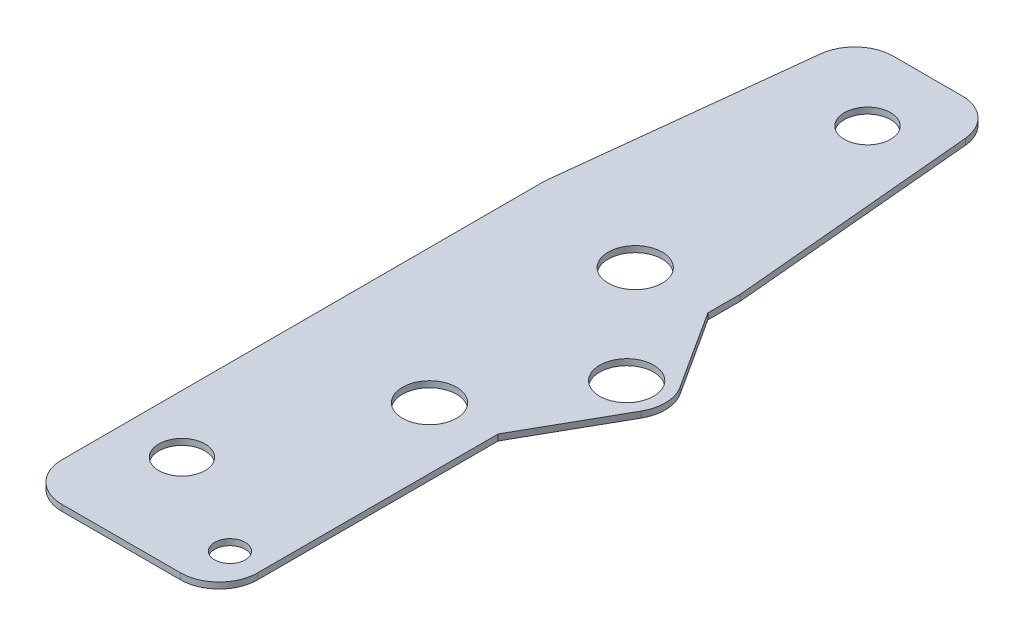
from build123d import *

# Parameters (mm, degrees)
SKETCH1_R           = 5.969
SKETCH1_R_2         = 3.960069723
SKETCH1_R_3         = 7
SKETCH1_R_4         = 6
BOSS_EXTRUDE1_DEPTH = 1.5875
SKETCH4_W           = 66.272407177
SKETCH4_H           = 27.800260981
CUT_EXTRUDE2_DEPTH  = 20
SKETCH5_R           = 6.683690244
BOSS_EXTRUDE2_DEPTH = 1.5875
SKETCH6_R           = 6
CUT_EXTRUDE3_DEPTH  = 2
FILLET3_R           = 10
FILLET4_R           = 10
BOSS_EXTRUDE6_START = -1.5875
BOSS_EXTRUDE6_DEPTH = 1.5875
SKETCH15_R          = 7
CUT_EXTRUDE5_DEPTH  = 1.5875


with BuildPart() as part:
    # Sketch1 → Boss-Extrude1 (new body)
    with BuildSketch(Plane(origin=(0, 0, 0), x_dir=(1, 0, 0), z_dir=(0, 1, 0))):
        with BuildLine():
            Line((42.32729629, 228.6), (10.454309325, 228.6))
            Line((10.454309325, 228.6), (0, 135.362739137))
            Line((0, 135.362739137), (0, 0))
            Line((0, 0), (24.327009544, 0))
            Line((24.327009544, 0), (50.8, 0))
            Line((50.8, 0), (50.8, 64.87909603))
            Line((50.8, 64.87909603), (50.8, 87.423477361))
            Line((50.8, 87.423477361), (50.8, 92.227575012))
            ThreePointArc((50.8, 92.227575012), (45.487330664, 101.060973635), (50.8, 109.894372259))
            Line((50.8, 109.894372259), (50.8, 120.619222808))
            Line((50.8, 120.619222808), (50.8, 135.362739137))
            Line((50.8, 135.362739137), (42.32729629, 228.6))
        make_face()
        with Locations((24.327009544, 25.509186042)):
            Circle(SKETCH1_R, mode=Mode.SUBTRACT)
        with Locations((42.32729629, 11.29561028)):
            Circle(SKETCH1_R_2, mode=Mode.SUBTRACT)
        with Locations((34.874098847, 70.532663582)):
            Circle(SKETCH1_R_3, mode=Mode.SUBTRACT)
        with Locations((31.203790865, 127.583278457)):
            Circle(SKETCH1_R_3, mode=Mode.SUBTRACT)
        with Locations((29.504213454, 189.557234372)):
            Circle(SKETCH1_R_4, mode=Mode.SUBTRACT)
    extrude(amount=BOSS_EXTRUDE1_DEPTH)

    # Sketch4 → Cut-Extrude2 (cut)
    with BuildSketch(Plane(origin=(0, 0, -228.6), x_dir=(-1, 0, 0), z_dir=(0, 0, -1))):
        with Locations((-28.174690156, -1.980940155)):
            Rectangle(SKETCH4_W, SKETCH4_H)
    extrude(amount=-CUT_EXTRUDE2_DEPTH, mode=Mode.SUBTRACT)

    # Sketch5 → Boss-Extrude2 (add)
    with BuildSketch(Plane.XZ):
        with Locations((24.327009544, -25.509186042)):
            Circle(SKETCH5_R)
    extrude(amount=-BOSS_EXTRUDE2_DEPTH)

    # Sketch6 → Cut-Extrude3 (cut)
    with BuildSketch(Plane.XZ):
        with Locations((15, -26.149675445)):
            Circle(SKETCH6_R)
    extrude(amount=-CUT_EXTRUDE3_DEPTH, mode=Mode.SUBTRACT)

    # Fillet3
    fillet3_edges = [part.edges().sort_by_distance(p)[0] for p in [
        (44.144746445, 0.79375, -208.6),
    ]]
    fillet(fillet3_edges, radius=FILLET3_R)

    # Fillet4
    fillet4_edges = [part.edges().sort_by_distance(p)[0] for p in [
        (50.8, 0.79375, 0),
        (0, 0.79375, 0),
        (8.211791854, 0.79375, -208.6),
    ]]
    fillet(fillet4_edges, radius=FILLET4_R)

    # Sketch13 → Boss-Extrude6 (add)
    with BuildSketch(Plane(origin=(0, 1.5875, 0), x_dir=(1, 0, 0), z_dir=(0, 1, 0)).offset(BOSS_EXTRUDE6_START)):
        with BuildLine():
            ThreePointArc((50.8, 109.894372259), (45.487330664, 101.060973635), (50.8, 92.227575012))
            Line((50.8, 92.227575012), (50.8, 72.427574483))
            Line((50.8, 72.427574483), (64.208356231, 96.126878668))
            ThreePointArc((64.208356231, 96.126878668), (65.503254935, 101.348794902), (63.910622899, 106.487733996))
            Line((63.910622899, 106.487733996), (50.8, 126.837740394))
            Line((50.8, 126.837740394), (50.8, 109.894372259))
        make_face()
    extrude(amount=BOSS_EXTRUDE6_DEPTH)

    # Sketch15 → Cut-Extrude5 (cut)
    with BuildSketch(Plane(origin=(0, 1.5875, 0), x_dir=(1, 0, 0), z_dir=(0, 1, 0))):
        with Locations((55.503835128, 101.072392843)):
            Circle(SKETCH15_R)
    extrude(amount=-CUT_EXTRUDE5_DEPTH, mode=Mode.SUBTRACT)


solid = part.part
